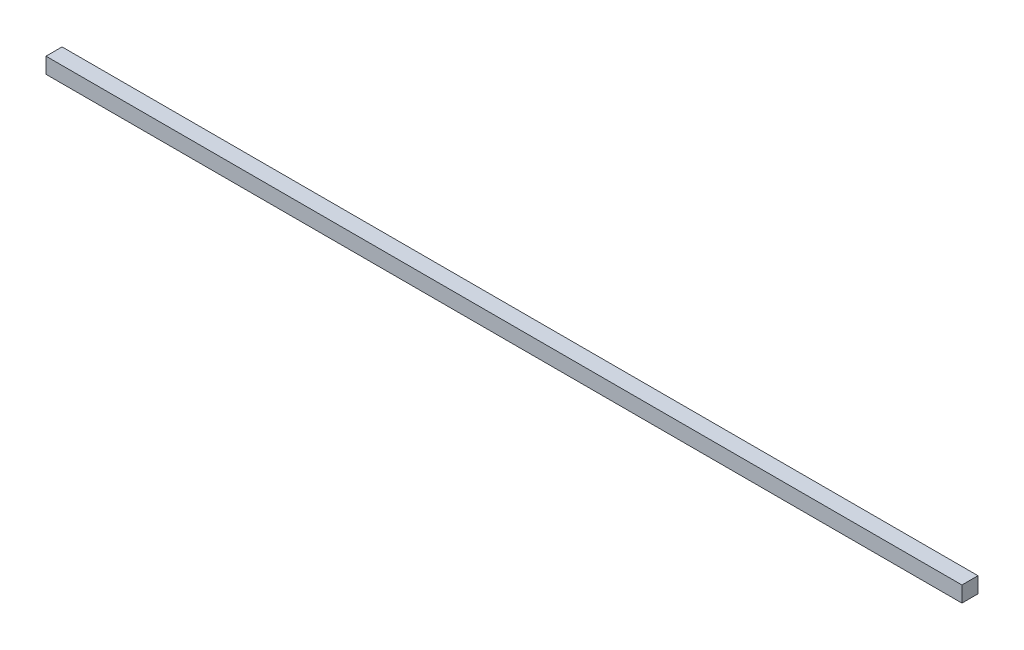
from build123d import *

# Parameters (mm, degrees)
SKETCH_1_W      = 569.770649127
SKETCH_1_H      = 9.782099076
EXTRUDE_1_DEPTH = 10


with BuildPart() as part:
    # Эскиз1 → Бобышка-Вытянуть1 (new body)
    with BuildSketch(Plane.XY):
        with Locations((81.756610091, 23.447598423)):
            Rectangle(SKETCH_1_W, SKETCH_1_H)
    extrude(amount=EXTRUDE_1_DEPTH)


solid = part.part
